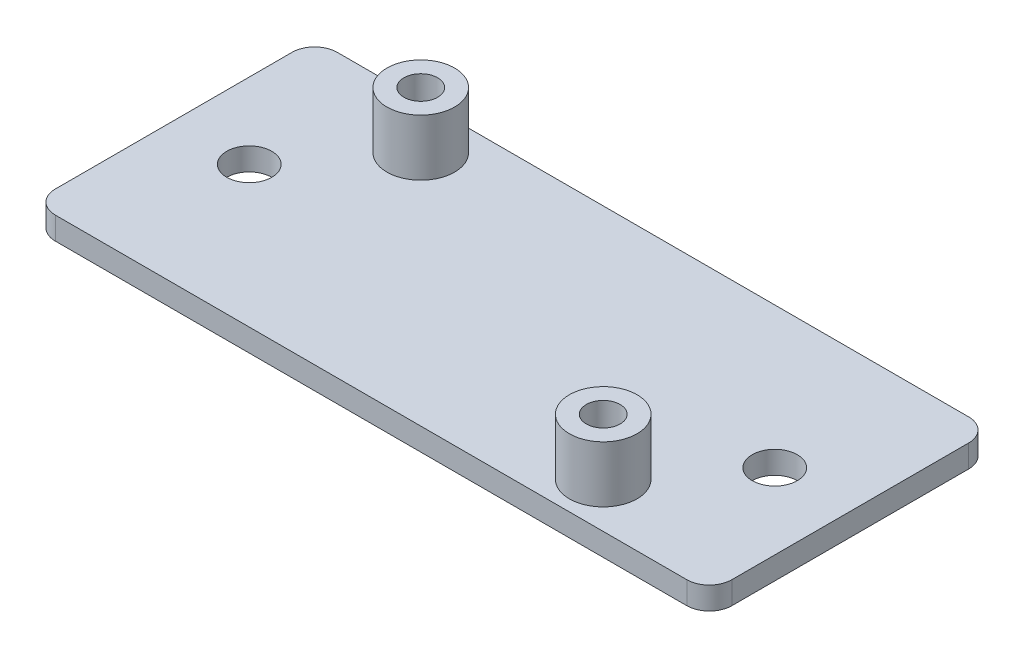
from build123d import *

# Parameters (mm, degrees)
SKETCH_1_W               = 60
SKETCH_1_H               = 25
EXTRUDE_1_DEPTH          = 2
SKETCH_2_R               = 3
EXTRUDE_2_DEPTH          = 5
CUT_EXTRUDE_1_DEPTH      = 66.375836515
CUT_EXTRUDE_1_DEPTH_BACK = 66.375836515
SKETCH_3_R               = 1.5
CUT_EXTRUDE_2_DEPTH      = 66.192024052
CUT_EXTRUDE_2_DEPTH_BACK = 66.192024052
SKETCH_4_R               = 2
FILLET_1_R               = 2
FILLET_2_R               = 2
FILLET_3_R               = 2
FILLET_4_R               = 2


with BuildPart() as part:
    # Эскиз1 → Бобышка-Вытянуть1 (new body)
    with BuildSketch(Plane(origin=(0, 0, 0), x_dir=(1, 0, 0), z_dir=(0, 1, 0))):
        with Locations((30, -12.5)):
            Rectangle(SKETCH_1_W, SKETCH_1_H)
    extrude(amount=EXTRUDE_1_DEPTH)

    # Эскиз2 → Бобышка-Вытянуть2 (add)
    with BuildSketch(Plane(origin=(0, 2, 0), x_dir=(1, 0, 0), z_dir=(0, 1, 0))):
        with Locations((13.41, -4)):
            Circle(SKETCH_2_R)
        with Locations((46.59, -21)):
            Circle(SKETCH_2_R)
    extrude(amount=EXTRUDE_2_DEPTH)

    # Эскиз3 → Вырез-Вытянуть1 (cut, two sides: drawn at the far end of the back side and taken through both)
    with BuildSketch(Plane(origin=(0, 7, 0), x_dir=(1, 0, 0), z_dir=(0, 1, 0)).offset(-CUT_EXTRUDE_1_DEPTH_BACK)):
        with Locations((13.41, -4)):
            Circle(SKETCH_3_R)
        with Locations((46.59, -21)):
            Circle(SKETCH_3_R)
    extrude(amount=CUT_EXTRUDE_1_DEPTH + CUT_EXTRUDE_1_DEPTH_BACK, mode=Mode.SUBTRACT)

    # Эскиз4 → Вырез-Вытянуть2 (cut, two sides: drawn at the far end of the back side and taken through both)
    with BuildSketch(Plane(origin=(0, 2, 0), x_dir=(1, 0, 0), z_dir=(0, 1, 0)).offset(-CUT_EXTRUDE_2_DEPTH_BACK)):
        with Locations((6.7, -12.5)):
            Circle(SKETCH_4_R)
        with Locations((53.3, -12.5)):
            Circle(SKETCH_4_R)
    extrude(amount=CUT_EXTRUDE_2_DEPTH + CUT_EXTRUDE_2_DEPTH_BACK, mode=Mode.SUBTRACT)

    # Скругление1
    fillet_1_edges = [part.edges().sort_by_distance(p)[0] for p in [
        (0, 1, 0),
    ]]
    fillet(fillet_1_edges, radius=FILLET_1_R)

    # Скругление2
    fillet_2_edges = [part.edges().sort_by_distance(p)[0] for p in [
        (0, 1, 25),
    ]]
    fillet(fillet_2_edges, radius=FILLET_2_R)

    # Скругление3
    fillet_3_edges = [part.edges().sort_by_distance(p)[0] for p in [
        (60, 1, 25),
    ]]
    fillet(fillet_3_edges, radius=FILLET_3_R)

    # Скругление4
    fillet_4_edges = [part.edges().sort_by_distance(p)[0] for p in [
        (60, 1, 0),
    ]]
    fillet(fillet_4_edges, radius=FILLET_4_R)


solid = part.part
